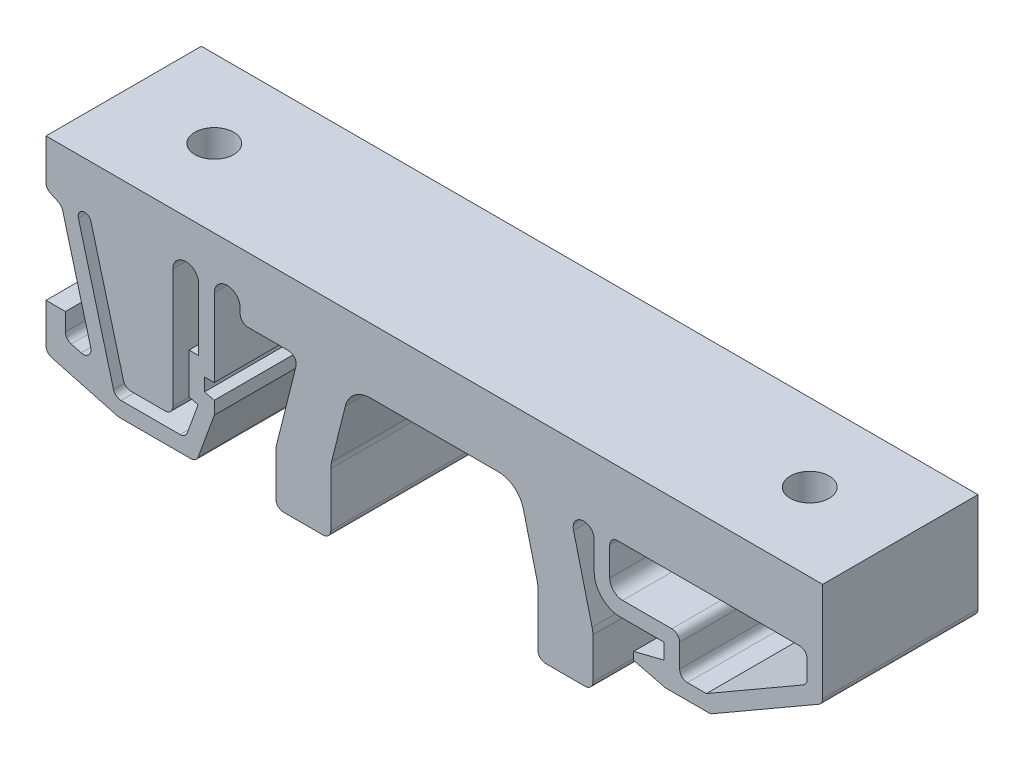
from build123d import *

# Parameters (mm, degrees)
BOSS_EXTRUDE1_DEPTH     = 6
CUT_EXTRUDE1_DEPTH      = 35.525353003
CUT_EXTRUDE1_DEPTH_BACK = 35.525353003
FILLET1_R               = 2
FILLET2_R               = 1
FILLET3_R               = 0.811424
FILLET4_R               = 2
FILLET5_R               = 1
FILLET6_R               = 1
FILLET7_R               = 0.5
FILLET8_R               = 0.6
SKETCH4_R               = 1.5
CUT_EXTRUDE2_DEPTH      = 8.5


with BuildPart() as part:
    # Sketch2 → Boss-Extrude1 (new, symmetric)
    with BuildSketch(Plane.XY):
        Polygon((6.5, 11), (-6.5, 11), (-8, 4.9838286), (-8, 0), (-12.25, 0), (-12.25, 3.981133366), (-10.5, 11), (-15, 11), (-15, 13), (-17, 13), (-17, 6), (-17.75, 6), (-17.75, 5), (-17, 4.813003998), (-17, 3.813003998), (-18.387819958, 0), (-24.387819958, 0), (-30, 1.50377911), (-30, 5.00377911), (-28.5, 5.00377911), (-28.5, 3.172407682), (-26.2783706, 2.577123878), (-28.785442178, 11.933642386), (-30, 12.5), (-30, 16), (0, 16), (30, 16), (30, 8), (21.339745962, 3), (17.839745962, 3), (15.4, 3.608296988), (15.4, 4.214079193), (17.75, 4.8), (17.75, 6), (12.35, 6), (12.35, 11), (10.5, 11), (12.25, 3.981133366), (12.25, 0), (8, 0), (8, 4.9838286), align=None)
    extrude(amount=BOSS_EXTRUDE1_DEPTH, both=True)

    # Sketch3 → Cut-Extrude1 (cut, two sides: drawn at the far end of the back side and taken through both)
    with BuildSketch(Plane.XY.offset(-CUT_EXTRUDE1_DEPTH_BACK)):
        Polygon((-27.626331186, 12.24422524), (-24.667039952, 1.2), (-19.228069004, 1.2), (-18.249764702, 3.88786898), (-18.95, 4.062457248), (-18.95, 7.2), (-18.2, 7.2), (-18.2, 13), (-20.2, 13), (-20.2, 2.2), (-23.899712964, 2.2), (-26.66040536, 12.503044285), align=None)
        Polygon((13.55, 11), (13.55, 7.2), (18.95, 7.2), (18.95, 4.2), (21.018206931, 4.2), (28.8, 8.692820323), (28.8, 11), align=None)
    extrude(amount=CUT_EXTRUDE1_DEPTH + CUT_EXTRUDE1_DEPTH_BACK, mode=Mode.SUBTRACT)

    # Fillet1
    fillet1_edges = [part.edges().sort_by_distance(p)[0] for p in [
        (12.35, 6, 0),
    ]]
    fillet(fillet1_edges, radius=FILLET1_R)

    # Fillet2
    fillet2_edges = [part.edges().sort_by_distance(p)[0] for p in [
        (13.55, 7.2, 0),
    ]]
    fillet(fillet2_edges, radius=FILLET2_R)

    # Fillet3
    fillet3_edges = [part.edges().sort_by_distance(p)[0] for p in [
        (12.35, 11, 0),
        (10.5, 11, 0),
    ]]
    fillet(fillet3_edges, radius=FILLET3_R)

    # Fillet4
    fillet4_edges = [part.edges().sort_by_distance(p)[0] for p in [
        (12.25, 3.981133366, 0),
        (8, 4.9838286, 0),
        (6.5, 11, 0),
        (-6.5, 11, 0),
        (-8, 4.9838286, 0),
        (-12.25, 3.981133366, 0),
    ]]
    fillet(fillet4_edges, radius=FILLET4_R)

    # Fillet5
    fillet5_edges = [part.edges().sort_by_distance(p)[0] for p in [
        (-20.2, 13, 0),
        (-18.2, 13, 0),
    ]]
    fillet(fillet5_edges, radius=FILLET5_R - 0.0001)  # a hair under: the kernel refuses the full size

    # Fillet6
    fillet6_edges = [part.edges().sort_by_distance(p)[0] for p in [
        (-15, 13, 0),
        (-17, 13, 0),
    ]]
    fillet(fillet6_edges, radius=FILLET6_R - 0.0001)  # a hair under: the kernel refuses the full size

    # Fillet7
    fillet7_edges = [part.edges().sort_by_distance(p)[0] for p in [
        (-27.626331186, 12.24422524, 0),
        (-26.66040536, 12.503044285, 0),
    ]]
    fillet(fillet7_edges, radius=FILLET7_R - 0.0001)  # a hair under: the kernel refuses the full size

    # Fillet8
    fillet8_edges = [part.edges().sort_by_distance(p)[0] for p in [
        (-23.899712964, 2.2, 0),
        (-20.2, 2.2, 0),
        (-19.228069004, 1.2, 0),
        (-24.667039952, 1.2, 0),
        (13.55, 11, 0),
        (28.8, 11, 0),
        (28.8, 8.692820323, 0),
        (18.95, 4.2, 0),
        (18.95, 7.2, 0),
        (12.25, 0, 0),
        (8, 0, 0),
        (-8, 0, 0),
        (-12.25, 0, 0),
        (-10.5, 11, 0),
        (-15, 11, 0),
        (-18.387819958, 0, 0),
        (-24.387819958, 0, 0),
        (-30, 1.50377911, 0),
        (-28.5, 3.172407682, 0),
        (-26.2783706, 2.577123878, 0),
        (-28.785442178, 11.933642386, 0),
        (-30, 12.5, 0),
        (30, 8, 0),
        (21.339745962, 3, 0),
        (17.839745962, 3, 0),
    ]]
    fillet(fillet8_edges, radius=FILLET8_R)

    # Sketch4 → Cut-Extrude2 (cut)
    with BuildSketch(Plane(origin=(0, 16, 0), x_dir=(1, 0, 0), z_dir=(0, 1, 0))):
        with Locations(Location((-23, 0, 0), (0, 0, 270))):
            Circle(SKETCH4_R)
        with Locations(Location((23, 0, 0), (0, 0, 180))):
            Circle(SKETCH4_R)
    extrude(amount=-CUT_EXTRUDE2_DEPTH, mode=Mode.SUBTRACT)


solid = part.part
